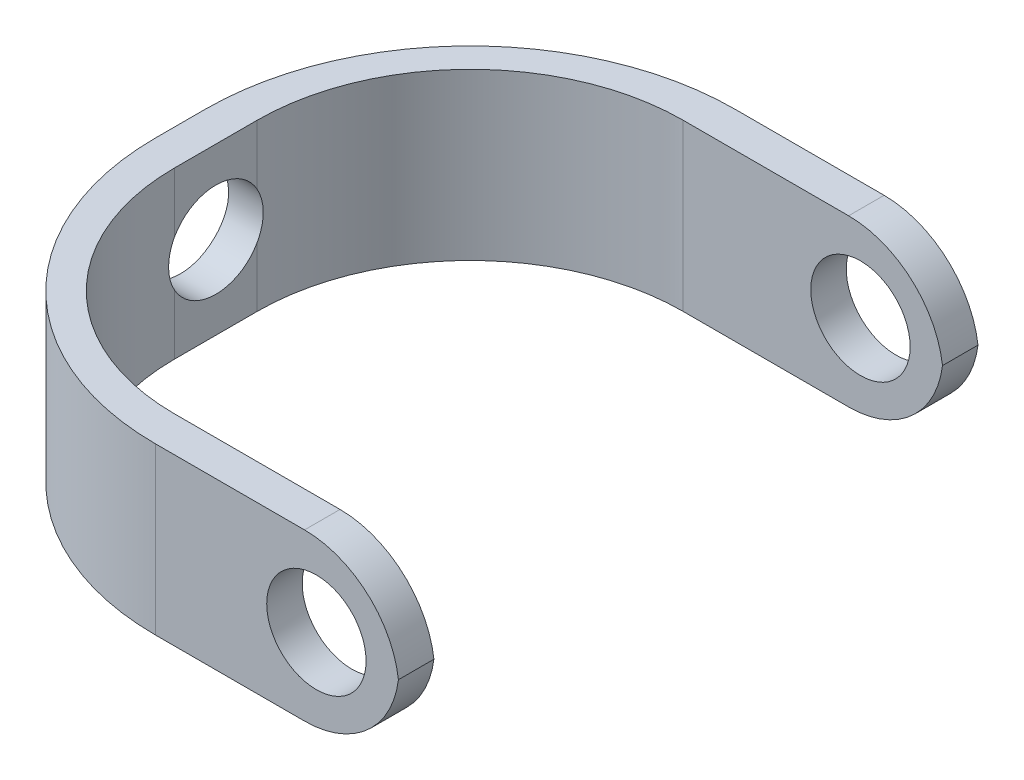
from build123d import *

# Parameters (mm, degrees)
EXTRUDE_1_DEPTH          = 7
CUT_EXTRUDE_1_DEPTH      = 34.339166156
CUT_EXTRUDE_1_DEPTH_BACK = 34.339166156
SKETCH_2_R               = 2.1
FILLET_1_R               = 4
CUT_EXTRUDE_2_DEPTH      = 26.689773137
CUT_EXTRUDE_2_DEPTH_BACK = 26.689773137
SKETCH_3_R               = 2


with BuildPart() as part:
    # Эскиз1 → Бобышка-Вытянуть1 (new body)
    with BuildSketch(Plane(origin=(0, 0, 0), x_dir=(1, 0, 0), z_dir=(0, 1, 0))):
        with BuildLine():
            Line((0, 10.75), (0, 12.25))
            Line((0, 12.25), (-10.3, 12.25))
            ThreePointArc((-10.3, 12.25), (-18.219595949, 8.969595949), (-21.5, 1.05))
            Line((-21.5, 1.05), (-21.5, -1.05))
            ThreePointArc((-21.5, -1.05), (-18.219595949, -8.969595949), (-10.3, -12.25))
            Line((-10.3, -12.25), (0, -12.25))
            Line((0, -12.25), (0, -10.75))
            Line((0, -10.75), (-11, -10.75))
            ThreePointArc((-11, -10.75), (-17.363961031, -8.113961031), (-20, -1.75))
            Line((-20, -1.75), (-20, 1.75))
            ThreePointArc((-20, 1.75), (-17.363961031, 8.113961031), (-11, 10.75))
            Line((-11, 10.75), (0, 10.75))
        make_face()
    extrude(amount=EXTRUDE_1_DEPTH)

    # Эскиз2 → Вырез-Вытянуть1 (cut, two sides: drawn at the far end of the back side and taken through both)
    with BuildSketch(Plane.XY.offset(12.25).offset(-CUT_EXTRUDE_1_DEPTH_BACK)):
        with Locations((-3.5, 3.5)):
            Circle(SKETCH_2_R)
    extrude(amount=CUT_EXTRUDE_1_DEPTH + CUT_EXTRUDE_1_DEPTH_BACK, mode=Mode.SUBTRACT)

    # Скругление1
    # the kernel refuses this fillet: 4 mm, written as the material it takes off along each edge
    with BuildSketch(Plane(origin=(0, 0, -0.75), x_dir=(-1, 0, 0), z_dir=(0, 0, -1)), Plane(origin=(0, 0, 22.25), x_dir=(-1, 0, 0), z_dir=(0, 0, -1))) as fillet_1_piece_1:
        with BuildLine():
            CenterArc((FILLET_1_R, FILLET_1_R), FILLET_1_R, 180, 90)
            Line((0, FILLET_1_R), (0, 0))
            Line((0, 0), (FILLET_1_R, 0))
        make_face()
    extrude(amount=21.5, mode=Mode.SUBTRACT)
    with BuildSketch(Plane(origin=(0, 7, -0.75), x_dir=(-1, 0, 0), z_dir=(0, 0, -1)), Plane(origin=(0, 7, 22.25), x_dir=(-1, 0, 0), z_dir=(0, 0, -1))) as fillet_1_piece_2:
        with BuildLine():
            CenterArc((FILLET_1_R, -FILLET_1_R), FILLET_1_R, 90, 90)
            Line((0, -FILLET_1_R), (0, 0))
            Line((0, 0), (FILLET_1_R, 0))
        make_face()
    extrude(amount=21.5, mode=Mode.SUBTRACT)

    # Эскиз3 → Вырез-Вытянуть2 (cut, two sides: drawn at the far end of the back side and taken through both)
    with BuildSketch(Plane.ZY.offset(21.5).offset(-CUT_EXTRUDE_2_DEPTH_BACK)):
        with Locations(Location((0, 3.5, 0), (0, 0, 28.955024372))):
            Circle(SKETCH_3_R)
    extrude(amount=CUT_EXTRUDE_2_DEPTH + CUT_EXTRUDE_2_DEPTH_BACK, mode=Mode.SUBTRACT)


solid = part.part
